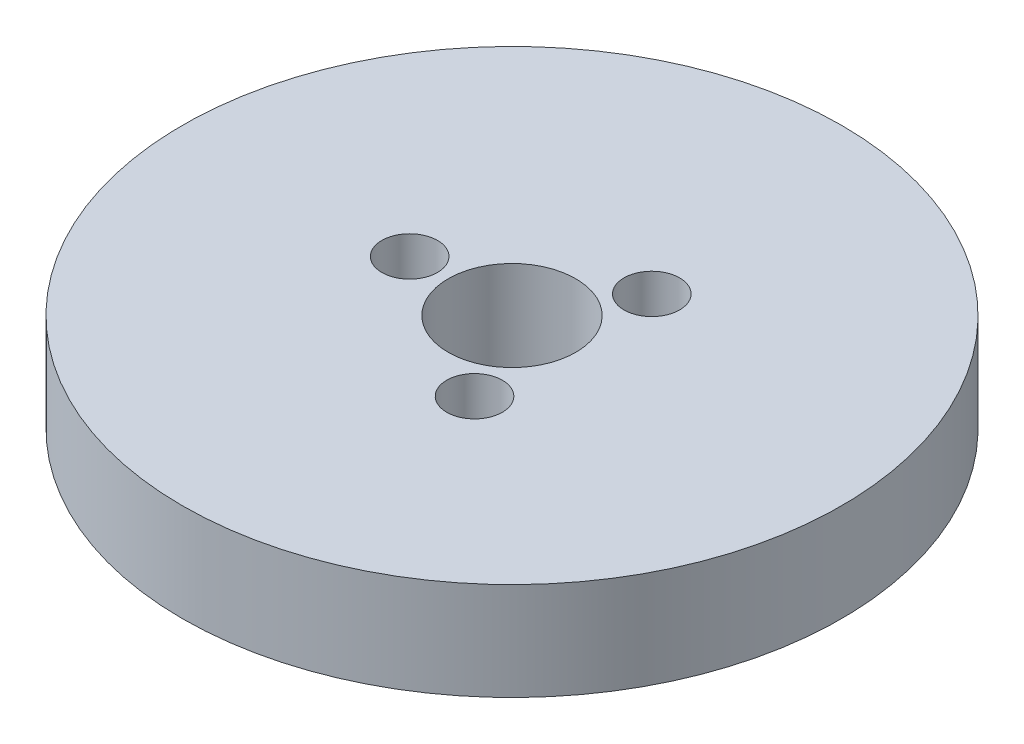
from build123d import *

# Parameters (mm, degrees)
SKETCH1_R           = 77.5
BOSS_EXTRUDE1_DEPTH = 23
SKETCH2_R           = 15
CUT_EXTRUDE1_DEPTH  = 112.98883873
SKETCH3_R           = 6.542031829
CUT_EXTRUDE2_DEPTH  = 20.176525744
CIRPATTERN1_COUNT   = 3


with BuildPart() as part:
    # Sketch1 → Boss-Extrude1 (new body)
    with BuildSketch(Plane(origin=(0, 0, 0), x_dir=(1, 0, 0), z_dir=(0, 1, 0))):
        Circle(SKETCH1_R)
    extrude(amount=BOSS_EXTRUDE1_DEPTH)

    # Sketch2 → Cut-Extrude1 (cut, through all)
    with BuildSketch(Plane(origin=(0, 0, 0), x_dir=(1, 0, 0), z_dir=(0, 1, 0))):
        Circle(SKETCH2_R)
    extrude(amount=CUT_EXTRUDE1_DEPTH, mode=Mode.SUBTRACT)

    # Sketch3 → Cut-Extrude2 (cut)
    with BuildSketch(Plane(origin=(0, 23, 0), x_dir=(1, 0, 0), z_dir=(0, 1, 0))):
        with Locations((-24.065310788, 0)):
            Circle(SKETCH3_R)
    cut_extrude2 = extrude(amount=-CUT_EXTRUDE2_DEPTH, mode=Mode.SUBTRACT)

    # CirPattern1: Cut-Extrude2 ×3 about axis
    cirpattern1_axis = Axis((0, 0, 0), (0, 1, 0))
    for i in range(1, CIRPATTERN1_COUNT):
        add(cut_extrude2.rotate(cirpattern1_axis, i * 360 / CIRPATTERN1_COUNT), mode=Mode.SUBTRACT)


solid = part.part
